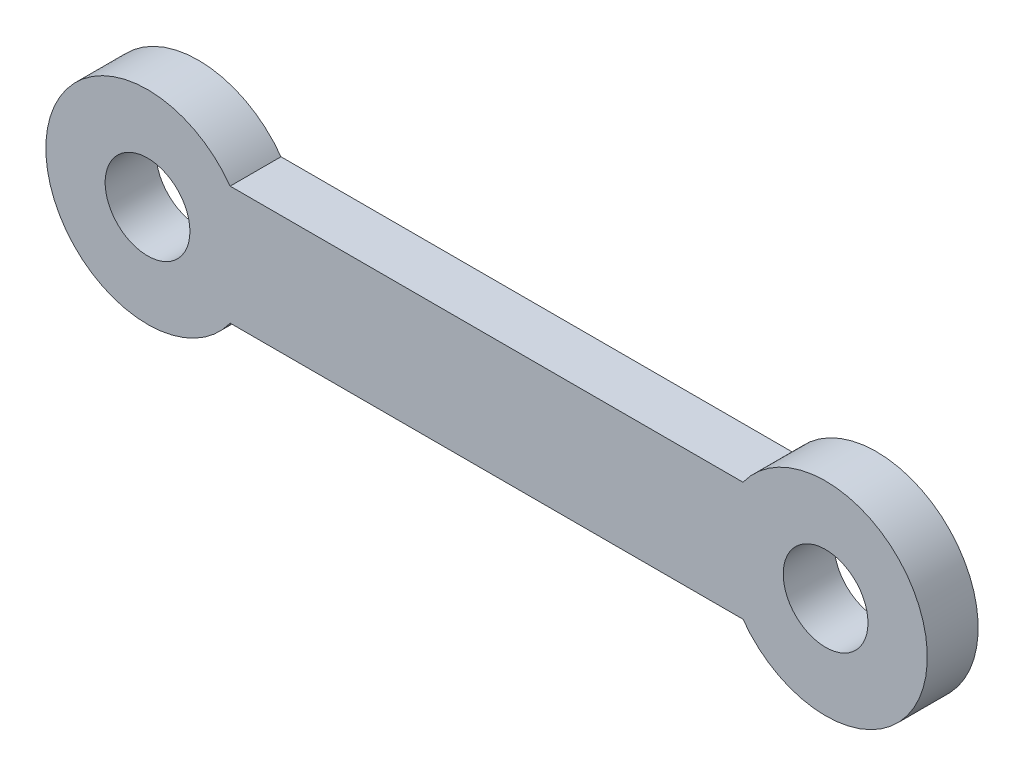
from build123d import *

# Parameters (mm, degrees)
EXTRUDE_START       = -3
EXTRUDE_1_DEPTH     = 6
SKETCH_2_R          = 5
CUT_EXTRUDE_1_DEPTH = 54.702886895


# Read off the part's stored shape, not the designer's step: 凸台-拉伸1
with BuildPart() as part:
    # 凸台-拉伸1 outline → 凸台-拉伸1 (new body)
    with BuildSketch(Plane.XY.offset(EXTRUDE_START)):
        with BuildLine():
            ThreePointArc((30.2532, -7), (52, 0), (30.2532, 7))
            Line((30.2532, 7), (-30.2532, 7))
            ThreePointArc((-30.2532, 7), (-52, 0), (-30.2532, -7))
            Line((-30.2532, -7), (30.2532, -7))
        make_face()
    extrude(amount=EXTRUDE_1_DEPTH)

    # 草图2 → 切除-拉伸1 (cut, through all)
    with BuildSketch(Plane.XY.offset(3)):
        with Locations((-40, 0)):
            Circle(SKETCH_2_R)
        with Locations((40, 0)):
            Circle(SKETCH_2_R)
    extrude(amount=-CUT_EXTRUDE_1_DEPTH, mode=Mode.SUBTRACT)


solid = part.part
